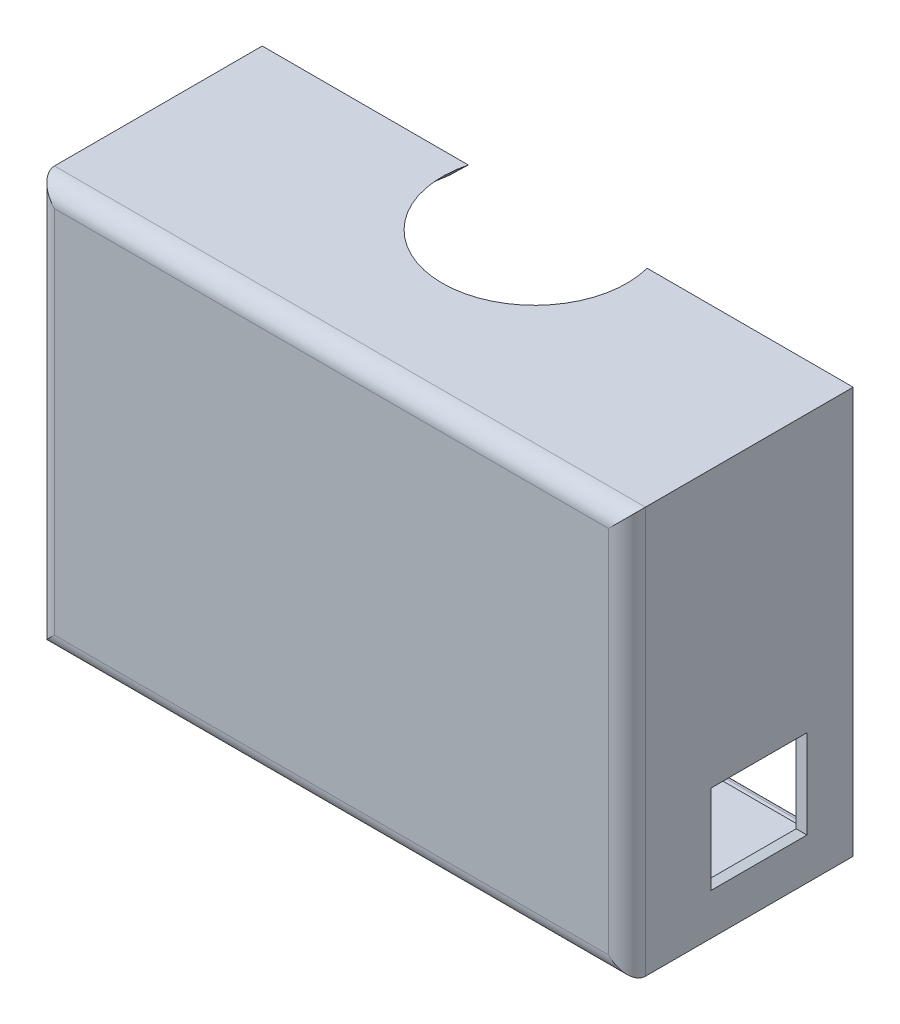
from build123d import *
from OCP.BRepFilletAPI import BRepFilletAPI_MakeChamfer

# Parameters (mm, degrees)
SKETCH1_W           = 81.28
SKETCH1_H           = 55.88
SKETCH1_W_2         = 76.2
SKETCH1_H_2         = 50.8
BOSS_EXTRUDE1_DEPTH = 28.575
SKETCH2_W           = 81.28
SKETCH2_H           = 55.88
BOSS_EXTRUDE2_DEPTH = 2.54
SKETCH5_W           = 13.208
SKETCH5_H           = 12.192
CUT_EXTRUDE1_DEPTH  = 2.54
SKETCH6_R           = 12.7
CUT_EXTRUDE2_DEPTH  = 2.54
CHAMFER4_SIZE       = 1.052102448
CHAMFER4_SIZE_2     = 2.54
CUT_EXTRUDE3_DEPTH  = 2.54
CHAMFER5_SIZE       = 2.54
FILLET2_R           = 0.762
FILLET3_R           = 2.54


with BuildPart() as part:
    # Sketch1 → Boss-Extrude1 (new body)
    with BuildSketch(Plane.XY):
        with Locations((2.94888724, 5.055504451)):
            Rectangle(SKETCH1_W, SKETCH1_H)
        with Locations((2.94888724, 5.055504451)):
            Rectangle(SKETCH1_W_2, SKETCH1_H_2, mode=Mode.SUBTRACT)
    extrude(amount=BOSS_EXTRUDE1_DEPTH)

    # Sketch2 → Boss-Extrude2 (add)
    with BuildSketch(Plane.XY.offset(28.575)):
        with Locations((2.94888724, 5.055504451)):
            Rectangle(SKETCH2_W, SKETCH2_H)
    extrude(amount=BOSS_EXTRUDE2_DEPTH)

    # Sketch5 → Cut-Extrude1 (cut)
    with BuildSketch(Plane(origin=(43.58888724, 0, 0), x_dir=(0, 0, -1), z_dir=(1, 0, 0))):
        with Locations((-12.954, -11.073495549)):
            Rectangle(SKETCH5_W, SKETCH5_H)
    extrude(amount=-CUT_EXTRUDE1_DEPTH, mode=Mode.SUBTRACT)

    # Sketch6 → Cut-Extrude2 (cut)
    with BuildSketch(Plane(origin=(0, 32.995504451, 0), x_dir=(1, 0, 0), z_dir=(0, 1, 0))):
        with Locations((2.94888724, -3.175)):
            Circle(SKETCH6_R)
    extrude(amount=-CUT_EXTRUDE2_DEPTH, mode=Mode.SUBTRACT)

    # Chamfer4
    chamfer4_edges_1 = [part.edges().sort_by_distance(p)[0] for p in [
        (41.04888724, -17.169495549, 12.954),
    ]]
    chamfer4_side_1 = [part.faces().sort_by_distance(p)[0] for p in [
        (41.04888724, -17.190537598, 12.954),
    ]]
    chamfer4_edges_2 = [part.edges().sort_by_distance(p)[0] for p in [
        (41.04888724, -11.073495549, 19.558),
    ]]
    chamfer4_side_2 = [part.faces().sort_by_distance(p)[0] for p in [
        (41.04888724, -11.073495549, 19.579042049),
    ]]
    chamfer4_edges_3 = [part.edges().sort_by_distance(p)[0] for p in [
        (41.04888724, -4.977495549, 12.954),
    ]]
    chamfer4_side_3 = [part.faces().sort_by_distance(p)[0] for p in [
        (41.04888724, -4.9564535, 12.954),
    ]]
    chamfer4_edges_4 = [part.edges().sort_by_distance(p)[0] for p in [
        (41.04888724, -11.073495549, 6.35),
    ]]
    chamfer4_side_4 = [part.faces().sort_by_distance(p)[0] for p in [
        (41.04888724, -11.073495549, 6.328957951),
    ]]
    chamfer4 = BRepFilletAPI_MakeChamfer(part.part.solid().wrapped)
    for e in chamfer4_edges_1:
        chamfer4.Add(CHAMFER4_SIZE - 0.0001, CHAMFER4_SIZE_2 - 0.0001, e.wrapped, chamfer4_side_1[0].wrapped)
    for e in chamfer4_edges_2:
        chamfer4.Add(CHAMFER4_SIZE - 0.0001, CHAMFER4_SIZE_2 - 0.0001, e.wrapped, chamfer4_side_2[0].wrapped)
    for e in chamfer4_edges_3:
        chamfer4.Add(CHAMFER4_SIZE - 0.0001, CHAMFER4_SIZE_2 - 0.0001, e.wrapped, chamfer4_side_3[0].wrapped)
    for e in chamfer4_edges_4:
        chamfer4.Add(CHAMFER4_SIZE - 0.0001, CHAMFER4_SIZE_2 - 0.0001, e.wrapped, chamfer4_side_4[0].wrapped)
    add(Compound.cast(chamfer4.Shape()), mode=Mode.REPLACE)  # a hair under: the kernel refuses the full size

    # Sketch8 → Cut-Extrude3 (cut)
    with BuildSketch(Plane(origin=(0, 0, 0), x_dir=(-1, 0, 0), z_dir=(0, 0, -1))):
        Polygon((-41.04888724, 30.455504451), (-21.99888724, 30.455504451), (-21.99888724, 31.725504451), (-42.31888724, 31.725504451), (-42.31888724, -21.614495549), (36.42111276, -21.614495549), (36.42111276, 31.725504451), (16.10111276, 31.725504451), (16.10111276, 30.455504451), (35.15111276, 30.455504451), (35.15111276, -20.344495549), (-41.04888724, -20.344495549), align=None)
    extrude(amount=-CUT_EXTRUDE3_DEPTH, mode=Mode.SUBTRACT)

    # Chamfer5
    chamfer5_edges = [part.edges().sort_by_distance(p)[0] for p in [
        (2.94888724, 30.455504451, 15.875),
    ]]
    chamfer(chamfer5_edges, length=CHAMFER5_SIZE - 0.0001)  # a hair under: the kernel refuses the full size

    # Fillet2
    fillet2_edges = [part.edges().sort_by_distance(p)[0] for p in [
        (32.15888724, 31.725504451, 0),
        (42.31888724, 5.055504451, 0),
        (2.94888724, -21.614495549, 0),
        (-36.42111276, 5.055504451, 0),
        (-26.26111276, 31.725504451, 0),
    ]]
    fillet(fillet2_edges, radius=FILLET2_R)

    # Fillet3
    fillet3_edges = [part.edges().sort_by_distance(p)[0] for p in [
        (-37.69111276, 5.055504451, 31.115),
        (2.94888724, -22.884495549, 31.115),
        (43.58888724, 5.055504451, 31.115),
        (2.94888724, 32.995504451, 31.115),
    ]]
    fillet(fillet3_edges, radius=FILLET3_R)


solid = part.part
